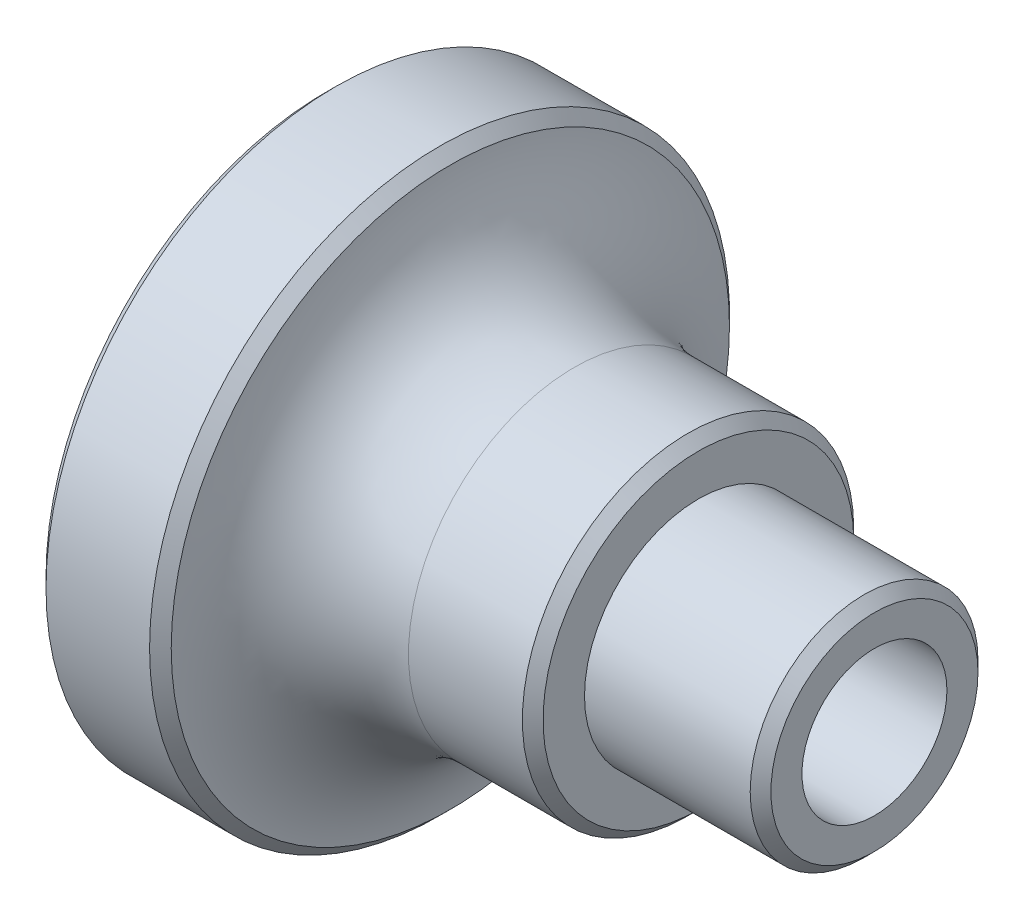
from build123d import *

# Parameters (mm, degrees)
SKETCH1_R           = 7
SKETCH1_R_2         = 1.75
BOSS_EXTRUDE1_DEPTH = 3
SKETCH2_R           = 4
SKETCH2_R_2         = 1.75
BOSS_EXTRUDE2_DEPTH = 6
FILLET1_R           = 3
SKETCH4_R           = 2.75
SKETCH4_R_2         = 1.75
BOSS_EXTRUDE3_DEPTH = 4.25


# Some blends are built 0.0001 mm under size
with BuildPart() as part:
    # Sketch1 → Boss-Extrude1 (new body)
    with BuildSketch(Plane(origin=(0, 0, 0), x_dir=(0, 0, -1), z_dir=(1, 0, 0))):
        Circle(SKETCH1_R)
        Circle(SKETCH1_R_2, mode=Mode.SUBTRACT)
    extrude(amount=BOSS_EXTRUDE1_DEPTH)

    # Sketch2 → Boss-Extrude2 (add)
    with BuildSketch(Plane(origin=(3, 0, 0), x_dir=(0, 0, -1), z_dir=(1, 0, 0))):
        Circle(SKETCH2_R)
        Circle(SKETCH2_R_2, mode=Mode.SUBTRACT)
    extrude(amount=BOSS_EXTRUDE2_DEPTH)

    # Fillet1
    fillet1_edges = [part.edges().sort_by_distance(p)[0] for p in [
        (3, 0, 4),
    ]]
    fillet(fillet1_edges, radius=FILLET1_R - 0.0001)  # a hair under: the kernel refuses the full size

    # Sketch4 → Boss-Extrude3 (add)
    with BuildSketch(Plane(origin=(9, 0, 0), x_dir=(0, 0, -1), z_dir=(1, 0, 0))):
        Circle(SKETCH4_R)
        Circle(SKETCH4_R_2, mode=Mode.SUBTRACT)
    extrude(amount=BOSS_EXTRUDE3_DEPTH)

    # Chamfer1
    # the kernel refuses this chamfer: 0.25 mm, written as the material it takes off along each edge
    with BuildSketch(Plane(origin=(9, 0, 0), x_dir=(0, 0, -1), z_dir=(0, -1, 0))) as chamfer1_piece_1:
        with BuildLine():
            Line((3.696966991, 0.053033009), (4.053033009, -0.303033009))
            Line((4.053033009, -0.303033009), (4.090533009, -0.303033009))
            ThreePointArc((4.090533009, -0.303033009), (4.0375, -0.151516504), (4.0375, 0))
            Line((4.0375, 0), (4, 0.0375))
            ThreePointArc((4, 0.0375), (3.848483496, 0.0375), (3.696966991, 0.090533009))
            Line((3.696966991, 0.090533009), (3.696966991, 0.053033009))
        make_face()
    revolve(axis=Axis((9, 0, 0), (1, 0, 0)), mode=Mode.SUBTRACT)
    with BuildSketch(Plane(origin=(0, 0, 0), x_dir=(0, 0, -1), z_dir=(0, -1, 0))) as chamfer1_piece_2:
        with BuildLine():
            Line((7.053033009, 0.303033009), (6.696966991, -0.053033009))
            Line((6.696966991, -0.053033009), (6.696966991, -0.090533009))
            ThreePointArc((6.696966991, -0.090533009), (6.848483496, -0.0375), (7, -0.0375))
            Line((7, -0.0375), (7.0375, 0))
            ThreePointArc((7.0375, 0), (7.0375, 0.151516504), (7.090533009, 0.303033009))
            Line((7.090533009, 0.303033009), (7.053033009, 0.303033009))
        make_face()
    revolve(axis=Axis((0, 0, 0), (1, 0, 0)), mode=Mode.SUBTRACT)
    with BuildSketch(Plane(origin=(13.25, 0, 0), x_dir=(0, 0, -1), z_dir=(0, -1, 0))) as chamfer1_piece_3:
        with BuildLine():
            Line((2.446966991, 0.053033009), (2.803033009, -0.303033009))
            Line((2.803033009, -0.303033009), (2.840533009, -0.303033009))
            ThreePointArc((2.840533009, -0.303033009), (2.7875, -0.151516504), (2.7875, 0))
            Line((2.7875, 0), (2.75, 0.0375))
            ThreePointArc((2.75, 0.0375), (2.598483496, 0.0375), (2.446966991, 0.090533009))
            Line((2.446966991, 0.090533009), (2.446966991, 0.053033009))
        make_face()
    revolve(axis=Axis((13.25, 0, 0), (1, 0, 0)), mode=Mode.SUBTRACT)
    with BuildSketch(Plane(origin=(3, 0, 0), x_dir=(0, 0, -1), z_dir=(0, -1, 0))) as chamfer1_piece_4:
        with BuildLine():
            Line((6.696966991, 0.053033009), (7.053033009, -0.303033009))
            Line((7.053033009, -0.303033009), (7.090533009, -0.303033009))
            ThreePointArc((7.090533009, -0.303033009), (7.0375, -0.151516504), (7.0375, 0))
            Line((7.0375, 0), (7, 0.0375))
            ThreePointArc((7, 0.0375), (6.848483496, 0.0375), (6.696966991, 0.090533009))
            Line((6.696966991, 0.090533009), (6.696966991, 0.053033009))
        make_face()
    revolve(axis=Axis((3, 0, 0), (1, 0, 0)), mode=Mode.SUBTRACT)
    with BuildSketch(Plane(origin=(0, 0, 0), x_dir=(0, 0, -1), z_dir=(0, -1, 0))) as chamfer1_piece_5:
        with BuildLine():
            Line((2.053033009, -0.053033009), (1.696966991, 0.303033009))
            Line((1.696966991, 0.303033009), (1.659466991, 0.303033009))
            ThreePointArc((1.659466991, 0.303033009), (1.7125, 0.151516504), (1.7125, 0))
            Line((1.7125, 0), (1.75, -0.0375))
            ThreePointArc((1.75, -0.0375), (1.901516504, -0.0375), (2.053033009, -0.090533009))
            Line((2.053033009, -0.090533009), (2.053033009, -0.053033009))
        make_face()
    revolve(axis=Axis((0, 0, 0), (1, 0, 0)), mode=Mode.SUBTRACT)


solid = part.part
